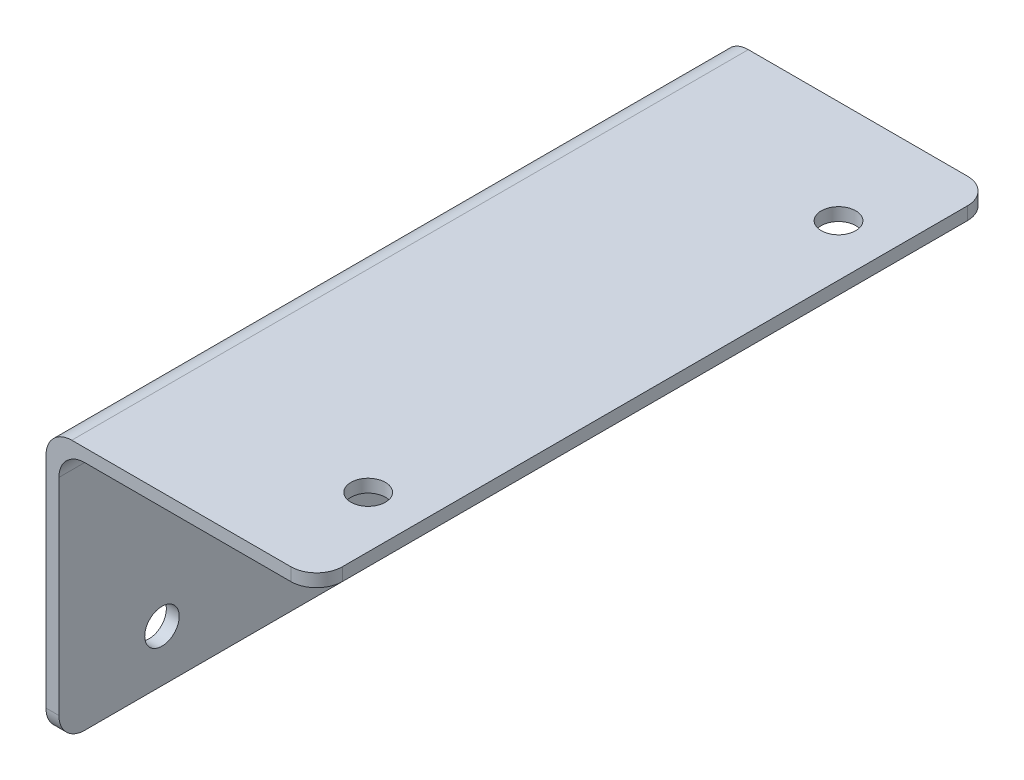
from build123d import *

# Parameters (mm, degrees)
BOSS_EXTRUDE1_DEPTH = 66.675
SKETCH3_R           = 1.7
CUT_EXTRUDE1_DEPTH  = 77.603742892
SKETCH6_R           = 1.7
CUT_EXTRUDE2_DEPTH  = 77.170890273
FILLET1_R           = 2.54
FILLET2_R           = 2.54


with BuildPart() as part:
    # Sketch2 → Boss-Extrude1 (new body)
    with BuildSketch(Plane.XY):
        Polygon((0, 0), (-1.27, 0), (-1.27, 26.67), (25.4, 26.67), (25.4, 25.4), (0, 25.4), align=None)
    extrude(amount=BOSS_EXTRUDE1_DEPTH)

    # Sketch3 → Cut-Extrude1 (cut, through all)
    with BuildSketch(Plane.ZY.offset(1.27)):
        with Locations((10.16, 5.08)):
            Circle(SKETCH3_R)
        with Locations((56.515, 5.08)):
            Circle(SKETCH3_R)
    extrude(amount=-CUT_EXTRUDE1_DEPTH, mode=Mode.SUBTRACT)

    # Sketch6 → Cut-Extrude2 (cut, through all)
    with BuildSketch(Plane(origin=(0, 26.67, 0), x_dir=(1, 0, 0), z_dir=(0, 1, 0))):
        with Locations((20.32, -10.16)):
            Circle(SKETCH6_R)
        with Locations((20.32, -56.515)):
            Circle(SKETCH6_R)
    extrude(amount=-CUT_EXTRUDE2_DEPTH, mode=Mode.SUBTRACT)

    # Fillet1
    fillet1_edges = [part.edges().sort_by_distance(p)[0] for p in [
        (25.4, 26.035, 0),
        (-0.635, 0, 0),
        (-0.635, 0, 66.675),
        (25.4, 26.035, 66.675),
    ]]
    fillet(fillet1_edges, radius=FILLET1_R)

    # Fillet2
    fillet2_edges = [part.edges().sort_by_distance(p)[0] for p in [
        (0, 25.4, 33.3375),
        (-1.27, 26.67, 33.3375),
    ]]
    fillet(fillet2_edges, radius=FILLET2_R)


solid = part.part
